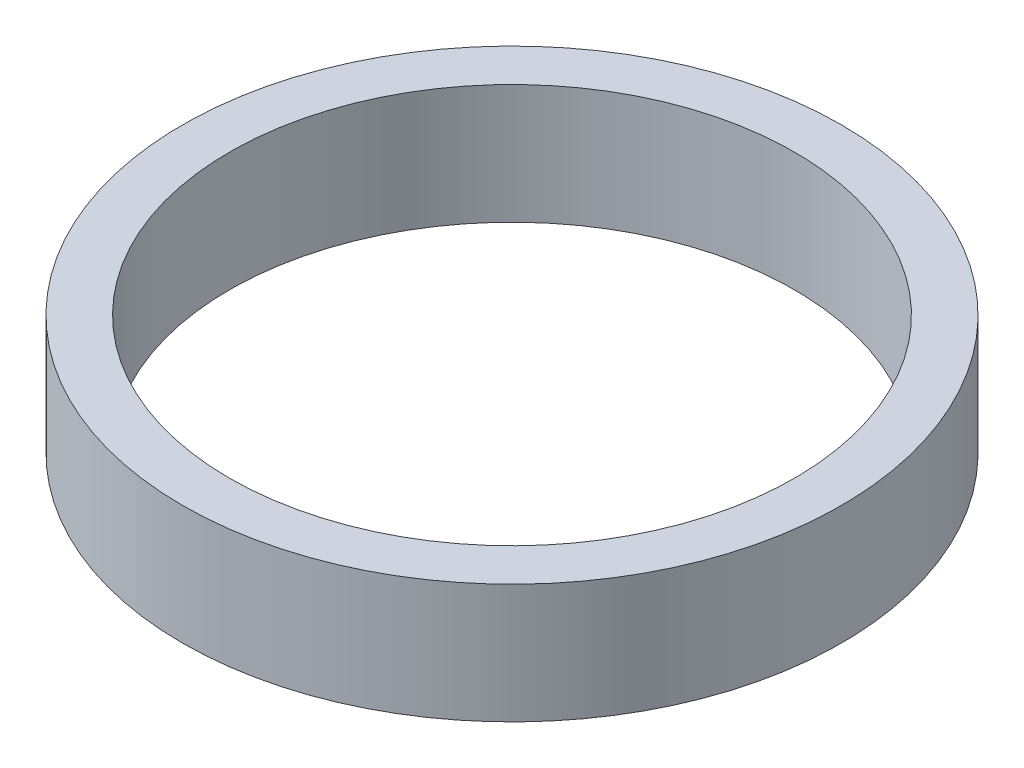
from build123d import *

# Parameters (mm, degrees)
SKETCH1_R           = 52.5
BOSS_EXTRUDE1_DEPTH = 19
SKETCH2_R           = 45
CUT_EXTRUDE1_DEPTH  = 77.638763038


with BuildPart() as part:
    # Sketch1 → Boss-Extrude1 (new body)
    with BuildSketch(Plane(origin=(0, 0, 0), x_dir=(1, 0, 0), z_dir=(0, 1, 0))):
        Circle(SKETCH1_R)
    extrude(amount=BOSS_EXTRUDE1_DEPTH)

    # Sketch2 → Cut-Extrude1 (cut, through all)
    with BuildSketch(Plane(origin=(0, 0, 0), x_dir=(1, 0, 0), z_dir=(0, 1, 0))):
        Circle(SKETCH2_R)
    extrude(amount=CUT_EXTRUDE1_DEPTH, mode=Mode.SUBTRACT)


solid = part.part
